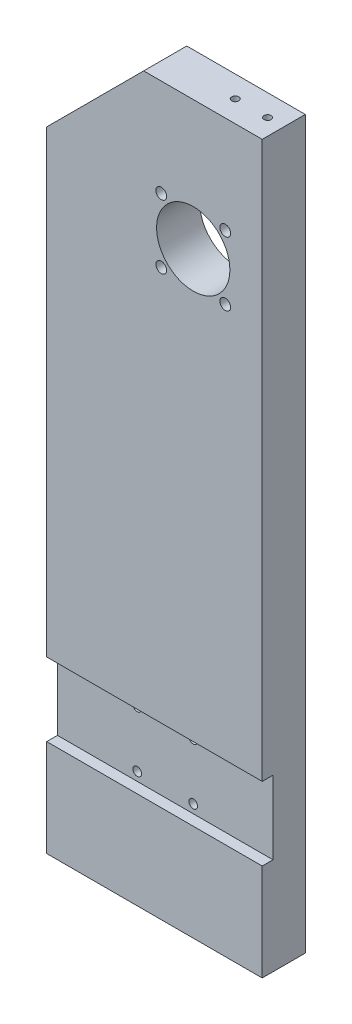
from build123d import *

# Parameters (mm, degrees)
SKETCH1_W             = 100
SKETCH1_H             = 337
SKETCH1_R             = 17
SKETCH1_R_2           = 2.5
SKETCH1_R_3           = 2
BOSS_EXTRUDE1_DEPTH   = 20
CHAMFER1_SIZE         = 45
SKETCH2_W             = 100
SKETCH2_H             = 34
CUT_EXTRUDE1_DEPTH    = 5
M4_TAPPED_HOLE1_D     = 3.3
M4_TAPPED_HOLE1_DEPTH = 16.1
M4_TAPPED_HOLE1_TIP   = 0.991420021
M4_TAPPED_HOLE2_D     = 3.3
M4_TAPPED_HOLE2_DEPTH = 15.1
M4_TAPPED_HOLE2_TIP   = 0.991420021


with BuildPart() as part:
    # Sketch1 → Boss-Extrude1 (new body)
    with BuildSketch(Plane.XY):
        with Locations((47.704546062, 452.000370419)):
            Rectangle(SKETCH1_W, SKETCH1_H)
        with Locations((65.704546062, 560.500370419)):
            Circle(SKETCH1_R, mode=Mode.SUBTRACT)
        with Locations((80.553788467, 575.349612824)):
            Circle(SKETCH1_R_2, mode=Mode.SUBTRACT)
        with Locations((80.553788467, 545.651128014)):
            Circle(SKETCH1_R_2, mode=Mode.SUBTRACT)
        with Locations((50.855303657, 545.651128014)):
            Circle(SKETCH1_R_2, mode=Mode.SUBTRACT)
        with Locations((50.855303657, 575.349612824)):
            Circle(SKETCH1_R_2, mode=Mode.SUBTRACT)
        with Locations((34.704546062, 358.500370419)):
            Circle(SKETCH1_R_3, mode=Mode.SUBTRACT)
        with Locations((60.704546062, 358.500370419)):
            Circle(SKETCH1_R_3, mode=Mode.SUBTRACT)
        with Locations((60.704546062, 332.500370419)):
            Circle(SKETCH1_R_3, mode=Mode.SUBTRACT)
        with Locations((34.704546062, 332.500370419)):
            Circle(SKETCH1_R_3, mode=Mode.SUBTRACT)
    extrude(amount=BOSS_EXTRUDE1_DEPTH)

    # Chamfer1
    chamfer1_edges = [part.edges().sort_by_distance(p)[0] for p in [
        (-2.295453938, 620.500370419, 10),
    ]]
    chamfer(chamfer1_edges, length=CHAMFER1_SIZE)

    # Sketch2 → Cut-Extrude1 (cut)
    with BuildSketch(Plane.XY.offset(20)):
        with Locations((47.704546062, 345.500370419)):
            Rectangle(SKETCH2_W, SKETCH2_H)
    extrude(amount=-CUT_EXTRUDE1_DEPTH, mode=Mode.SUBTRACT)

    # M4 Tapped Hole1
    with Locations(Plane(origin=(7.704546062, 283.500370419, 10), x_dir=(0, 0, -1), z_dir=(0, -1, 0))):
        with Locations((0, 0), (0, 20), (0, 60), (0, 80)):
            Hole(M4_TAPPED_HOLE1_D / 2, depth=M4_TAPPED_HOLE1_DEPTH)
            with Locations((0, 0, -(M4_TAPPED_HOLE1_DEPTH + M4_TAPPED_HOLE1_TIP / 2))):  # 118° drill point
                Cone(0, M4_TAPPED_HOLE1_D / 2, M4_TAPPED_HOLE1_TIP, mode=Mode.SUBTRACT)

    # M4 Tapped Hole2
    with Locations(Plane(origin=(90.204546062, 625.500370419, 10), x_dir=(0, 0, 1), z_dir=(0, 1, 0))):
        with Locations((0, 0), (0, -15)):
            Hole(M4_TAPPED_HOLE2_D / 2, depth=M4_TAPPED_HOLE2_DEPTH)
            with Locations((0, 0, -(M4_TAPPED_HOLE2_DEPTH + M4_TAPPED_HOLE2_TIP / 2))):  # 118° drill point
                Cone(0, M4_TAPPED_HOLE2_D / 2, M4_TAPPED_HOLE2_TIP, mode=Mode.SUBTRACT)


solid = part.part
